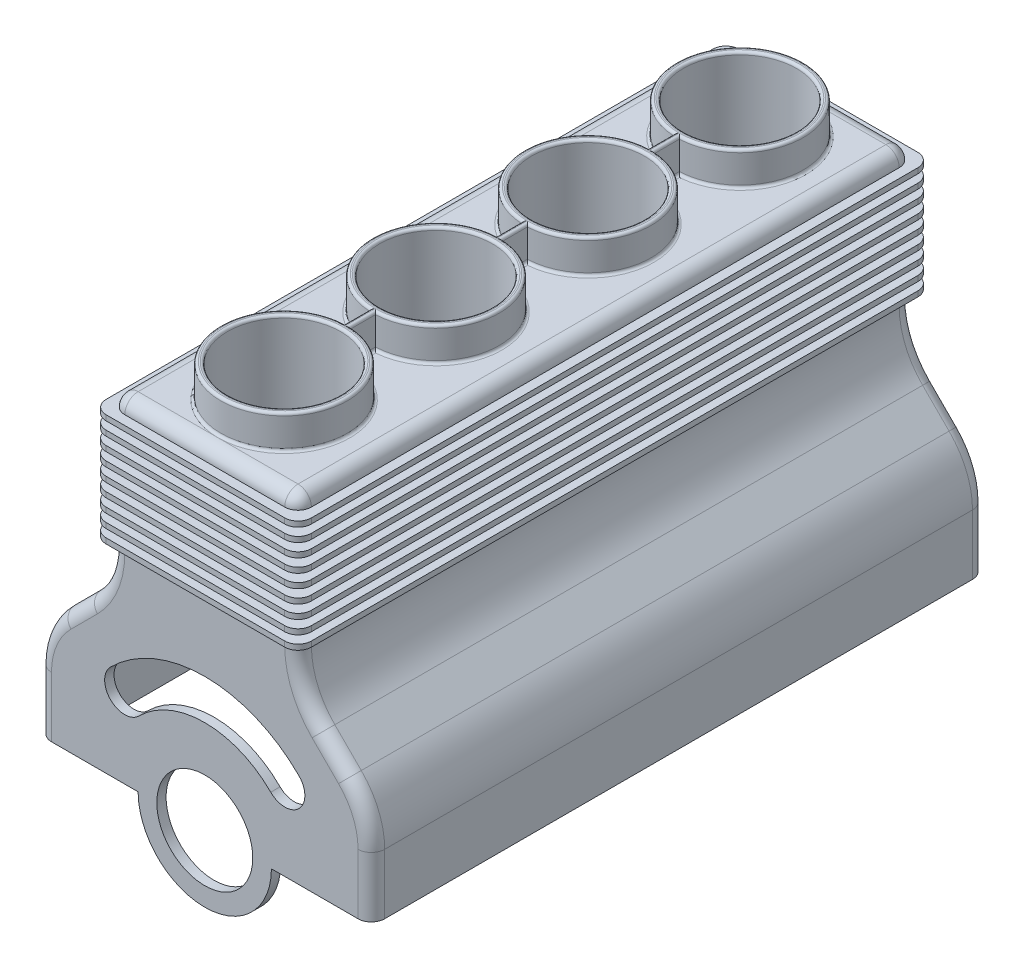
from build123d import *

# Parameters (mm, degrees)
BOSS_EXTRUDE1_DEPTH     = 230.5
SKETCH3_W               = 120
SKETCH3_H               = 461
BOSS_EXTRUDE2_DEPTH     = 4
LPATTERN1_COUNT         = 9
LPATTERN1_PITCH         = 10
SKETCH2_R               = 42.5
CUT_EXTRUDE1_DEPTH      = 114
FILLET2_R               = 10
BOSS_EXTRUDE3_START     = 25
SKETCH2_3_R             = 42.5
BOSS_EXTRUDE3_DEPTH     = 25
FILLET3_R               = 2
FILLET4_R               = 2
CUT_EXTRUDE2_DEPTH      = 223.5
CUT_EXTRUDE2_DEPTH_BACK = 217.5
CUT_EXTRUDE3_DEPTH      = 558.02244876


with BuildPart() as part:
    # Sketch1 → Boss-Extrude1 (new, symmetric)
    with BuildSketch(Plane.XY):
        with BuildLine():
            Line((60, 250), (-60, 250))
            ThreePointArc((-60, 250), (-67.071067812, 247.071067812), (-70, 240))
            Line((-70, 240), (-70, 149.852813742))
            ThreePointArc((-70, 149.852813742), (-74.567228049, 126.8918078), (-87.573593129, 107.426406871))
            Line((-87.573593129, 107.426406871), (-107.426406871, 87.573593129))
            ThreePointArc((-107.426406871, 87.573593129), (-120.432771951, 68.1081922), (-125, 45.147186258))
            Line((-125, 45.147186258), (-125, 0))
            Line((-125, 0), (-50, 0))
            Line((-50, 0), (-36, 0))
            ThreePointArc((-36, 0), (0, 36), (36, 0))
            Line((36, 0), (50, 0))
            Line((50, 0), (125, 0))
            Line((125, 0), (125, 45.147186258))
            ThreePointArc((125, 45.147186258), (120.432771951, 68.1081922), (107.426406871, 87.573593129))
            Line((107.426406871, 87.573593129), (87.573593129, 107.426406871))
            ThreePointArc((87.573593129, 107.426406871), (74.567228049, 126.8918078), (70, 149.852813742))
            Line((70, 149.852813742), (70, 240))
            ThreePointArc((70, 240), (67.071067812, 247.071067812), (60, 250))
        make_face()
        with BuildLine():
            Line((-36, 0), (-50, 0))
            ThreePointArc((-50, 0), (0, -50), (50, 0))
            Line((50, 0), (36, 0))
            ThreePointArc((36, 0), (0, -36), (-36, 0))
        make_face()
    extrude(amount=BOSS_EXTRUDE1_DEPTH, both=True)

    # Sketch3 → Boss-Extrude2 (add)
    with BuildSketch(Plane(origin=(0, 240, 0), x_dir=(1, 0, 0), z_dir=(0, 1, 0))):
        with BuildLine():
            Line((-67, 237.5), (67, 237.5))
            ThreePointArc((67, 237.5), (74.071067812, 234.571067812), (77, 227.5))
            Line((77, 227.5), (77, -227.5))
            ThreePointArc((77, -227.5), (74.071067812, -234.571067812), (67, -237.5))
            Line((67, -237.5), (-67, -237.5))
            ThreePointArc((-67, -237.5), (-74.071067812, -234.571067812), (-77, -227.5))
            Line((-77, -227.5), (-77, 227.5))
            ThreePointArc((-77, 227.5), (-74.071067812, 234.571067812), (-67, 237.5))
        make_face()
        Rectangle(SKETCH3_W, SKETCH3_H, mode=Mode.SUBTRACT)
    boss_extrude2 = extrude(amount=-BOSS_EXTRUDE2_DEPTH)

    # LPattern1: Boss-Extrude2 ×9
    with Locations(*[(0, -i * LPATTERN1_PITCH, 0) for i in range(1, LPATTERN1_COUNT)]):
        add(boss_extrude2)

    # Sketch2 → Cut-Extrude1 (cut)
    with BuildSketch(Plane(origin=(0, 250, 0), x_dir=(1, 0, 0), z_dir=(0, 1, 0))):
        with Locations(Location((0, 171, 0), (0, 0, 180))):
            Circle(SKETCH2_R)
        with Locations(Location((0, 57, 0), (0, 0, 180))):
            Circle(SKETCH2_R)
        with Locations(Location((0, -171, 0), (0, 0, 180))):
            Circle(SKETCH2_R)
        with Locations(Location((0, -57, 0), (0, 0, 180))):
            Circle(SKETCH2_R)
    extrude(amount=-CUT_EXTRUDE1_DEPTH, mode=Mode.SUBTRACT)

    # Fillet2
    fillet2_edges = [part.edges().sort_by_distance(p)[0] for p in [
        (70, 223, -230.5),
        (-70, 223, -230.5),
        (70, 223, 230.5),
        (-70, 223, 230.5),
        (-70, 213, -230.5),
        (-70, 213, 230.5),
        (70, 213, -230.5),
        (70, 213, 230.5),
        (-74.567228049, 126.8918078, 230.5),
        (70, 203, 230.5),
        (-70, 203, 230.5),
        (-67.071067812, 247.071067812, -230.5),
        (70, 203, -230.5),
        (0, 250, -230.5),
        (-70, 203, -230.5),
        (67.071067812, 247.071067812, -230.5),
        (74.567228049, 126.8918078, -230.5),
        (97.5, 97.5, -230.5),
        (120.432771951, 68.1081922, -230.5),
        (125, 22.573593129, -230.5),
        (-97.5, 97.5, 230.5),
        (-70, 193, -230.5),
        (-70, 193, 230.5),
        (70, 193, -230.5),
        (70, 193, 230.5),
        (-125, 22.573593129, -230.5),
        (-120.432771951, 68.1081922, -230.5),
        (-97.5, 97.5, -230.5),
        (-74.567228049, 126.8918078, -230.5),
        (70, 183, 230.5),
        (-70, 183, 230.5),
        (-120.432771951, 68.1081922, 230.5),
        (70, 183, -230.5),
        (-70, 183, -230.5),
        (-70, 173, -230.5),
        (-70, 173, 230.5),
        (70, 173, -230.5),
        (70, 173, 230.5),
        (-125, 22.573593129, 230.5),
        (70, 163, 230.5),
        (-70, 163, 230.5),
        (70, 163, -230.5),
        (-70, 163, -230.5),
        (-70, 152.926406871, -230.5),
        (-70, 152.926406871, 230.5),
        (70, 152.926406871, -230.5),
        (70, 152.926406871, 230.5),
        (125, 22.573593129, 230.5),
        (-70, 233, -230.5),
        (70, 233, -230.5),
        (120.432771951, 68.1081922, 230.5),
        (-70, 233, 230.5),
        (70, 233, 230.5),
        (97.5, 97.5, 230.5),
        (74.567228049, 126.8918078, 230.5),
        (67.071067812, 247.071067812, 230.5),
        (0, 250, 230.5),
        (-67.071067812, 247.071067812, 230.5),
    ]]
    fillet(fillet2_edges, radius=FILLET2_R - 0.0001)  # a hair under: the kernel refuses the full size

    # Sketch2<3> → Boss-Extrude3 (add)
    with BuildSketch(Plane(origin=(0, 250, 0), x_dir=(1, 0, 0), z_dir=(0, 1, 0)).offset(BOSS_EXTRUDE3_START)):
        with BuildLine():
            Line((-2, 9.542123941), (-2, -9.542123941))
            ThreePointArc((-2, -9.542123941), (-47.5, -57), (-2, -104.457876059))
            Line((-2, -104.457876059), (-2, -123.542123941))
            ThreePointArc((-2, -123.542123941), (0, -218.5), (2, -123.542123941))
            Line((2, -123.542123941), (2, -104.457876059))
            ThreePointArc((2, -104.457876059), (47.5, -57), (2, -9.542123941))
            Line((2, -9.542123941), (2, 9.542123941))
            ThreePointArc((2, 9.542123941), (47.5, 57), (2, 104.457876059))
            Line((2, 104.457876059), (2, 123.542123941))
            ThreePointArc((2, 123.542123941), (0, 218.5), (-2, 123.542123941))
            Line((-2, 123.542123941), (-2, 104.457876059))
            ThreePointArc((-2, 104.457876059), (-47.5, 57), (-2, 9.542123941))
        make_face()
        with Locations(Location((0, -171, 0), (0, 0, 180))):
            Circle(SKETCH2_3_R, mode=Mode.SUBTRACT)
        with Locations(Location((0, -57, 0), (0, 0, 180))):
            Circle(SKETCH2_3_R, mode=Mode.SUBTRACT)
        with Locations(Location((0, 57, 0), (0, 0, 180))):
            Circle(SKETCH2_3_R, mode=Mode.SUBTRACT)
        with Locations(Location((0, 171, 0), (0, 0, 180))):
            Circle(SKETCH2_3_R, mode=Mode.SUBTRACT)
    extrude(amount=-BOSS_EXTRUDE3_DEPTH)

    # Fillet3
    fillet3_edges = [part.edges().sort_by_distance(p)[0] for p in [
        (0, 275, 218.5),
        (2, 275, 114),
        (47.5, 275, 57),
        (2, 275, 0),
        (47.5, 275, -57),
        (2, 275, -114),
        (0, 275, -218.5),
        (-2, 275, -114),
        (-47.5, 275, -57),
        (-2, 275, 0),
        (-47.5, 275, 57),
        (-2, 275, 114),
    ]]
    fillet(fillet3_edges, radius=FILLET3_R - 0.0001)  # a hair under: the kernel refuses the full size

    # Fillet4
    fillet4_edges = [part.edges().sort_by_distance(p)[0] for p in [
        (0, 250, 218.5),
        (2, 250, 114),
        (47.5, 250, 57),
        (2, 250, 0),
        (47.5, 250, -57),
        (2, 250, -114),
        (0, 250, -218.5),
        (-2, 250, -114),
        (-47.5, 250, -57),
        (-2, 250, 0),
        (-47.5, 250, 57),
        (-2, 250, 114),
        (42.5, 275, 171),
        (42.5, 275, 57),
        (42.5, 275, -57),
        (42.5, 275, -171),
    ]]
    fillet(fillet4_edges, radius=FILLET4_R)

    # Sketch4 → Cut-Extrude2 (cut, two sides: drawn at the far end of the back side and taken through both)
    with BuildSketch(Plane.XY.offset(-CUT_EXTRUDE2_DEPTH_BACK)):
        with BuildLine():
            ThreePointArc((76.966991411, 96.819805153), (60.709035062, 121.151556315), (55, 149.852813742))
            Line((55, 149.852813742), (55, 151))
            Line((55, 151), (-55, 151))
            Line((-55, 151), (-55, 149.852813742))
            ThreePointArc((-55, 149.852813742), (-60.709035062, 121.151556315), (-76.966991411, 96.819805153))
            Line((-76.966991411, 96.819805153), (-96.819805153, 76.966991411))
            ThreePointArc((-96.819805153, 76.966991411), (-106.574578963, 62.367940714), (-110, 45.147186258))
            Line((-110, 45.147186258), (-110, 0))
            Line((-110, 0), (-50, 0))
            ThreePointArc((-50, 0), (0, -50), (50, 0))
            Line((50, 0), (110, 0))
            Line((110, 0), (110, 45.147186258))
            ThreePointArc((110, 45.147186258), (106.574578963, 62.367940714), (96.819805153, 76.966991411))
            Line((96.819805153, 76.966991411), (76.966991411, 96.819805153))
        make_face()
    extrude(amount=CUT_EXTRUDE2_DEPTH + CUT_EXTRUDE2_DEPTH_BACK, mode=Mode.SUBTRACT)

    # Sketch11 → Cut-Extrude3 (cut, through all)
    with BuildSketch(Plane(origin=(0, 0, -230.5), x_dir=(-1, 0, 0), z_dir=(0, 0, -1))):
        with BuildLine():
            ThreePointArc((70.710678119, 70.710678119), (0, 100), (-70.710678119, 70.710678119))
            ThreePointArc((-70.710678119, 70.710678119), (-70.710678119, 49.497474683), (-49.497474683, 49.497474683))
            ThreePointArc((-49.497474683, 49.497474683), (0, 70), (49.497474683, 49.497474683))
            ThreePointArc((49.497474683, 49.497474683), (70.710678119, 49.497474683), (70.710678119, 70.710678119))
        make_face()
    extrude(amount=-CUT_EXTRUDE3_DEPTH, mode=Mode.SUBTRACT)


solid = part.part
